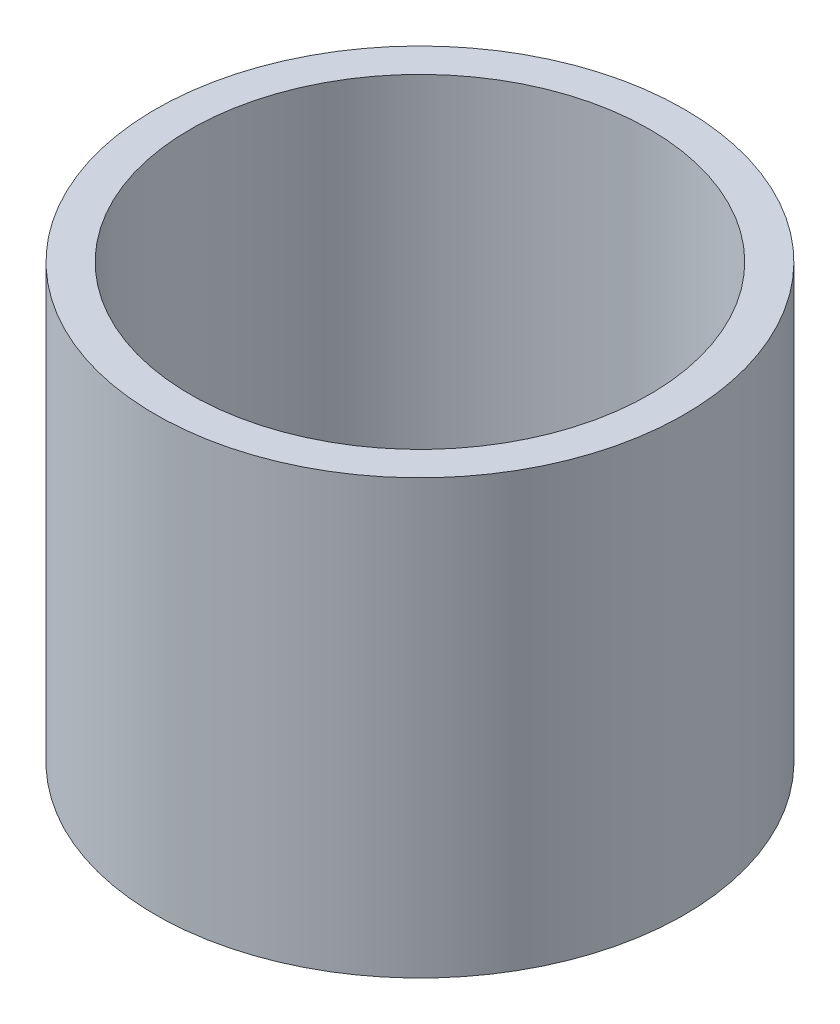
from build123d import *

# Parameters (mm, degrees)
SKETCH1_R           = 30
BOSS_EXTRUDE1_DEPTH = 49.150577907
SKETCH2_R           = 26.057270721
CUT_EXTRUDE1_DEPTH  = 65.929032864


with BuildPart() as part:
    # Sketch1 → Boss-Extrude1 (new body)
    with BuildSketch(Plane(origin=(0, 0, 0), x_dir=(1, 0, 0), z_dir=(0, 1, 0))):
        Circle(SKETCH1_R)
    extrude(amount=BOSS_EXTRUDE1_DEPTH)

    # Sketch2 → Cut-Extrude1 (cut, through all)
    with BuildSketch(Plane(origin=(0, 0, 0), x_dir=(1, 0, 0), z_dir=(0, 1, 0))):
        Circle(SKETCH2_R)
    extrude(amount=CUT_EXTRUDE1_DEPTH, mode=Mode.SUBTRACT)


solid = part.part
